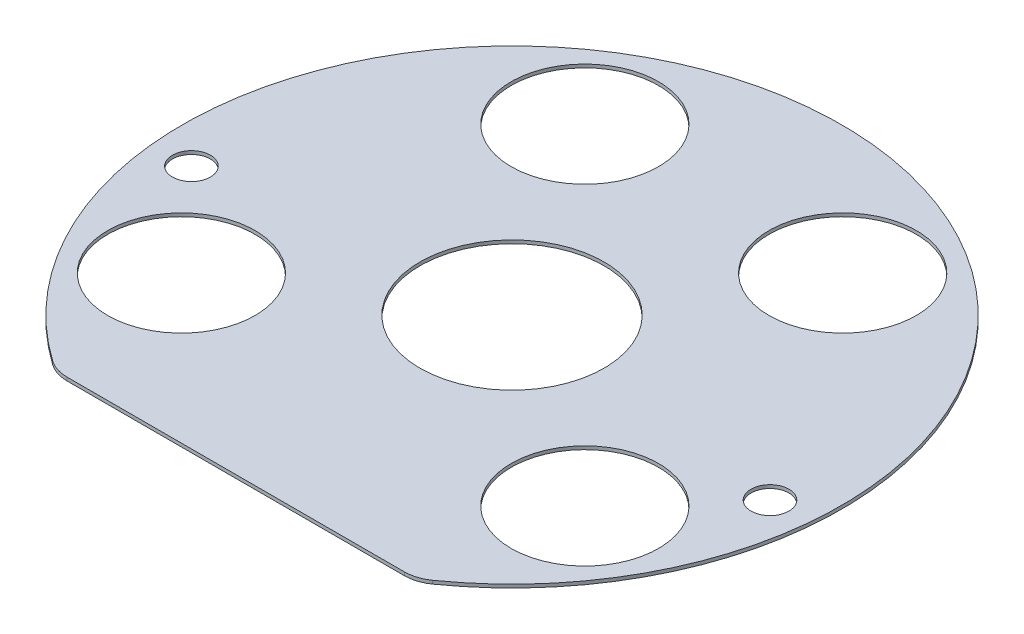
from build123d import *

# Parameters (mm, degrees)
BOSS_EXTRUDE1_DEPTH = 0.91
SKETCH9_R           = 5.15
CUT_EXTRUDE3_DEPTH  = 127.575385048
VISION_PATTERN_R    = 25
VISION_PATTERN_R_2  = 20
CUT_EXTRUDE4_DEPTH  = 127.575385048
FILLET1_R           = 10


with BuildPart() as part:
    # Sketch1 → Boss-Extrude1 (new body)
    with BuildSketch(Plane(origin=(0, 0, 0), x_dir=(1, 0, 0), z_dir=(0, 1, 0))):
        with BuildLine():
            Line((-48.839021284, -75), (48.839021284, -75))
            ThreePointArc((48.839021284, -75), (0, 89.5), (-48.839021284, -75))
        make_face()
    extrude(amount=-BOSS_EXTRUDE1_DEPTH)

    # Sketch9 → Cut-Extrude3 (cut, through all)
    with BuildSketch(Plane(origin=(0, 0, 0), x_dir=(1, 0, 0), z_dir=(0, 1, 0))):
        with Locations((78.541209232, -8.501673503)):
            Circle(SKETCH9_R)
        with Locations((-78.541209232, -8.501673503)):
            Circle(SKETCH9_R)
    extrude(amount=-CUT_EXTRUDE3_DEPTH, mode=Mode.SUBTRACT)

    # Vision Pattern → Cut-Extrude4 (cut, through all)
    with BuildSketch(Plane(origin=(0, 0, 0), x_dir=(1, 0, 0), z_dir=(0, 1, 0))):
        Circle(VISION_PATTERN_R)
        with Locations((54.772255751, -35)):
            Circle(VISION_PATTERN_R_2)
        with Locations((-54.772255751, -35)):
            Circle(VISION_PATTERN_R_2)
        with Locations((35, 54.772255751)):
            Circle(VISION_PATTERN_R_2)
        with Locations((-35, 54.772255751)):
            Circle(VISION_PATTERN_R_2)
    extrude(amount=-CUT_EXTRUDE4_DEPTH, mode=Mode.SUBTRACT)

    # Fillet1
    fillet1_edges = [part.edges().sort_by_distance(p)[0] for p in [
        (48.839021284, -0.455, 75),
        (-48.839021284, -0.455, 75),
    ]]
    fillet(fillet1_edges, radius=FILLET1_R)


solid = part.part
